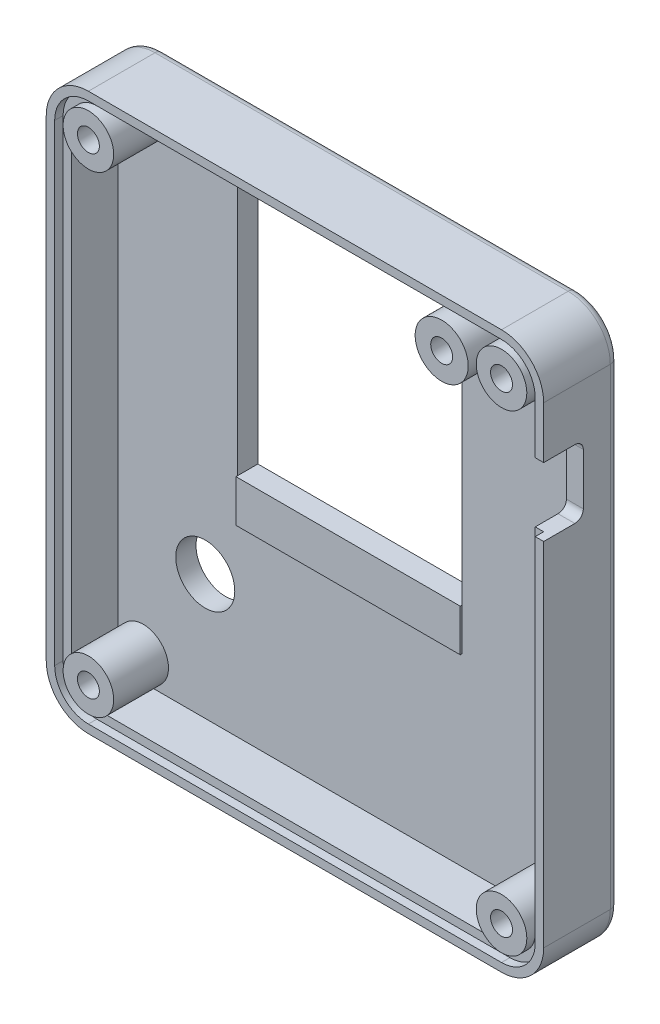
from build123d import *

# Parameters (mm, degrees)
SKETCH_1_W          = 59
SKETCH_1_H          = 66
SKETCH_1_R          = 3.5
EXTRUDE_1_DEPTH     = 2.4
SKETCH_4_W          = 59
SKETCH_4_H          = 66
EXTRUDE_6_DEPTH     = 5.5
FILLET_1_R          = 5
FILLET_2_R          = 5
SKETCH_14_R         = 3
SKETCH_14_R_2       = 1.3
EXTRUDE_7_DEPTH     = 6.5
EXTRUDE_10_DEPTH    = 1
FILLET_3_R          = 1
CUT_EXTRUDE_1_DEPTH = 10
SKETCH_23_W         = 26.6
SKETCH_23_H         = 29.9
CUT_EXTRUDE_4_DEPTH = 52
SKETCH_24_W         = 26.6
SKETCH_24_H         = 5
EXTRUDE_11_DEPTH    = 0.2
SKETCH_25_W         = 26.6
SKETCH_25_H         = 5
EXTRUDE_12_DEPTH    = 0.2
SKETCH_26_R         = 3.14740537
SKETCH_26_R_2       = 1.3
EXTRUDE_13_DEPTH    = 6.5
SKETCH_27_R         = 4
CUT_EXTRUDE_5_DEPTH = 0.4
SKETCH_28_R         = 3.175170102
EXTRUDE_14_DEPTH    = 0.4
FILLET_4_R          = 0.5
FILLET_5_R          = 0.5


with BuildPart() as part:
    # Эскиз1 → Бобышка-Вытянуть1 (new body)
    with BuildSketch(Plane.XY):
        with Locations((29.5, -33)):
            Rectangle(SKETCH_1_W, SKETCH_1_H)
        with Locations((12.36, -49.17)):
            Circle(SKETCH_1_R, mode=Mode.SUBTRACT)
    extrude(amount=EXTRUDE_1_DEPTH)

    # Эскиз4 → Бобышка-Вытянуть6 (add)
    with BuildSketch(Plane.XY.offset(2.4)):
        with Locations((29.5, -33)):
            Rectangle(SKETCH_4_W, SKETCH_4_H)
        with BuildLine():
            Line((5.1, -2), (53.9, -2))
            ThreePointArc((53.9, -2), (56.092031022, -2.907968978), (57, -5.1))
            Line((57, -5.1), (57, -60.9))
            ThreePointArc((57, -60.9), (56.092031022, -63.092031022), (53.9, -64))
            Line((53.9, -64), (5.1, -64))
            ThreePointArc((5.1, -64), (2.907968978, -63.092031022), (2, -60.9))
            Line((2, -60.9), (2, -5.1))
            ThreePointArc((2, -5.1), (2.907968978, -2.907968978), (5.1, -2))
        make_face(mode=Mode.SUBTRACT)
    extrude(amount=EXTRUDE_6_DEPTH)

    # Скругление1
    fillet_1_edges = [part.edges().sort_by_distance(p)[0] for p in [
        (0, 0, 3.95),
    ]]
    fillet(fillet_1_edges, radius=FILLET_1_R)

    # Скругление2
    fillet_2_edges = [part.edges().sort_by_distance(p)[0] for p in [
        (59, 0, 3.95),
        (59, -66, 3.95),
        (0, -66, 3.95),
    ]]
    fillet(fillet_2_edges, radius=FILLET_2_R)

    # Эскиз14 → Бобышка-Вытянуть7 (add)
    # profile 1 of 4: a face of its own
    with BuildSketch(Plane.XY.offset(2.4)):
        with Locations(Location((5, -5, 0), (0, 0, 180.947144451))):
            Circle(SKETCH_14_R)
        with Locations(Location((5, -5, 0), (0, 0, 180))):
            Circle(SKETCH_14_R_2, mode=Mode.SUBTRACT)
    # profile 2 of 4: a face of its own
    with BuildSketch(Plane.XY.offset(2.4)):
        with Locations(Location((5, -61, 0), (0, 0, 179.052855549))):
            Circle(SKETCH_14_R)
        with Locations(Location((5, -61, 0), (0, 0, 180))):
            Circle(SKETCH_14_R_2, mode=Mode.SUBTRACT)
    # profile 3 of 4: a face of its own
    with BuildSketch(Plane.XY.offset(2.4)):
        with Locations(Location((54, -61, 0), (0, 0, 269.052855549))):
            Circle(SKETCH_14_R)
        with Locations(Location((54, -61, 0), (0, 0, 180))):
            Circle(SKETCH_14_R_2, mode=Mode.SUBTRACT)
    # profile 4 of 4: a face of its own
    with BuildSketch(Plane.XY.offset(2.4)):
        with Locations(Location((54, -5, 0), (0, 0, 90.947144451))):
            Circle(SKETCH_14_R)
        with Locations(Location((54, -5, 0), (0, 0, 180))):
            Circle(SKETCH_14_R_2, mode=Mode.SUBTRACT)
    extrude(amount=EXTRUDE_7_DEPTH)

    # Скругление3
    fillet_3_edges = [part.edges().sort_by_distance(p)[0] for p in [
        (0, -33, 0),
        (1.464466094, -1.464466094, 0),
        (29.5, -66, 0),
        (29.5, 0, 0),
        (59, -33, 0),
        (57.535533906, -1.464466094, 0),
        (57.535533906, -64.535533906, 0),
        (1.464466094, -64.535533906, 0),
    ]]
    fillet(fillet_3_edges, radius=FILLET_3_R)


with BuildPart() as body_2:
    # Эскиз15 → Бобышка-Вытянуть10 (new body)
    with BuildSketch(Plane.XY.offset(7.9)):
        with BuildLine():
            Line((5, 0), (54, 0))
            ThreePointArc((54, 0), (57.535533906, -1.464466094), (59, -5))
            Line((59, -5), (59, -61))
            ThreePointArc((59, -61), (57.535533906, -64.535533906), (54, -66))
            Line((54, -66), (5, -66))
            ThreePointArc((5, -66), (1.464466094, -64.535533906), (0, -61))
            Line((0, -61), (0, -5))
            ThreePointArc((0, -5), (1.464466094, -1.464466094), (5, 0))
        make_face()
        with BuildLine():
            Line((5, -1), (54, -1))
            ThreePointArc((54, -1), (56.828427125, -2.171572875), (58, -5))
            Line((58, -5), (58, -61))
            ThreePointArc((58, -61), (56.828427125, -63.828427125), (54, -65))
            Line((54, -65), (5, -65))
            ThreePointArc((5, -65), (2.171572875, -63.828427125), (1, -61))
            Line((1, -61), (1, -5))
            ThreePointArc((1, -5), (2.171572875, -2.171572875), (5, -1))
        make_face(mode=Mode.SUBTRACT)
    extrude(amount=EXTRUDE_10_DEPTH)


with BuildPart() as cut_extrude_1_tool:
    # Эскиз20 → Вырез-Вытянуть1 (new body)
    with BuildSketch(Plane(origin=(59, 0, 0), x_dir=(0, 0, -1), z_dir=(1, 0, 0))):
        with BuildLine():
            Line((-8.9, -11.15), (-5.2, -11.15))
            ThreePointArc((-5.2, -11.15), (-4.492893219, -11.442893219), (-4.2, -12.15))
            Line((-4.2, -12.15), (-4.2, -18.25))
            ThreePointArc((-4.2, -18.25), (-4.492893219, -18.957106781), (-5.2, -19.25))
            Line((-5.2, -19.25), (-8.9, -19.25))
            Line((-8.9, -19.25), (-8.9, -11.15))
        make_face()
    extrude(amount=-CUT_EXTRUDE_1_DEPTH)


with BuildPart() as part_1:
    add(part.part)

    # Вырез-Вытянуть1: cut by cut_extrude_1_tool
    add(cut_extrude_1_tool.part, mode=Mode.SUBTRACT)

    # Эскиз23 → Вырез-Вытянуть4 (cut)
    with BuildSketch(Plane(origin=(0, 0, 0), x_dir=(-1, 0, 0), z_dir=(0, 0, -1))):
        with Locations((-29.500023272, -22.190991649)):
            Rectangle(SKETCH_23_W, SKETCH_23_H)
    extrude(amount=-CUT_EXTRUDE_4_DEPTH, mode=Mode.SUBTRACT)

    # Эскиз24 → Бобышка-Вытянуть11 (add)
    with BuildSketch(Plane.XY.offset(2.4)):
        with Locations((29.500023272, -4.740991649)):
            Rectangle(SKETCH_24_W, SKETCH_24_H)
    extrude(amount=EXTRUDE_11_DEPTH)

    # Эскиз25 → Бобышка-Вытянуть12 (add)
    with BuildSketch(Plane.XY.offset(2.4)):
        with Locations((29.500023272, -39.640991649)):
            Rectangle(SKETCH_25_W, SKETCH_25_H)
    extrude(amount=EXTRUDE_12_DEPTH)


with BuildPart() as body_2_1:
    add(body_2.part)

    # Вырез-Вытянуть1: cut by cut_extrude_1_tool
    add(cut_extrude_1_tool.part, mode=Mode.SUBTRACT)


    add(part_1.part)  # Бобышка-Вытянуть13 merges part
    # Эскиз26 → Бобышка-Вытянуть13 (add)
    with BuildSketch(Plane.XY.offset(2.4)):
        with Locations(Location((46.9, -5.7, 0), (0, 0, 180))):
            Circle(SKETCH_26_R)
        with Locations(Location((46.9, -5.7, 0), (0, 0, 180))):
            Circle(SKETCH_26_R_2, mode=Mode.SUBTRACT)
    extrude(amount=EXTRUDE_13_DEPTH)

    # Эскиз27 → Вырез-Вытянуть5 (cut)
    with BuildSketch(Plane(origin=(0, 0, 0), x_dir=(-1, 0, 0), z_dir=(0, 0, -1))):
        with Locations((-44.3, -54.4)):
            Circle(SKETCH_27_R)
    extrude(amount=-CUT_EXTRUDE_5_DEPTH, mode=Mode.SUBTRACT)

    # Эскиз28 → Бобышка-Вытянуть14 (add)
    with BuildSketch(Plane(origin=(0, 0, 0.4), x_dir=(-1, 0, 0), z_dir=(0, 0, -1))):
        with Locations((-44.3, -54.4)):
            Circle(SKETCH_28_R)
    extrude(amount=EXTRUDE_14_DEPTH)

    # Скругление4
    # the kernel refuses this fillet: 0.5 mm, written as the material it takes off along each edge
    with BuildSketch(Plane(origin=(44.3, -54.4, 0), x_dir=(-1, 0, 0), z_dir=(0, -1, 0))) as fillet_4_piece_1:
        with BuildLine():
            CenterArc((4.489897949, -0.5), FILLET_4_R, 90, 78.463040967)
            Line((4, -0.4), (3.990202041, -0.398))
            ThreePointArc((3.990202041, -0.398), (3.99, -0.2), (3.99, 0))
            Line((3.99, 0), (4, 0.01))
            Line((4, 0.01), (4.489897949, 0.01))
            Line((4.489897949, 0.01), (4.489897949, 0))
        make_face()
    revolve(axis=Axis((44.3, -54.4, 0), (0, 0, -1)), mode=Mode.SUBTRACT)

    # Скругление5
    # the kernel refuses this fillet: 0.5 mm, written as the material it takes off along each edge
    with BuildSketch(Plane(origin=(44.3, -54.4, 0), x_dir=(-1, 0, 0), z_dir=(0, -1, 0))) as fillet_5_piece_1:
        with BuildLine():
            CenterArc((2.685272154, -0.5), FILLET_5_R, 11.536959033, 78.463040967)
            Line((2.685272154, 0), (2.685272154, 0.01))
            Line((2.685272154, 0.01), (3.175170102, 0.01))
            Line((3.175170102, 0.01), (3.185170102, 0))
            ThreePointArc((3.185170102, 0), (3.185170102, -0.2), (3.184968061, -0.398))
            Line((3.184968061, -0.398), (3.175170102, -0.4))
        make_face()
    revolve(axis=Axis((44.3, -54.4, 0), (0, 0, -1)), mode=Mode.SUBTRACT)


solid = body_2_1.part
